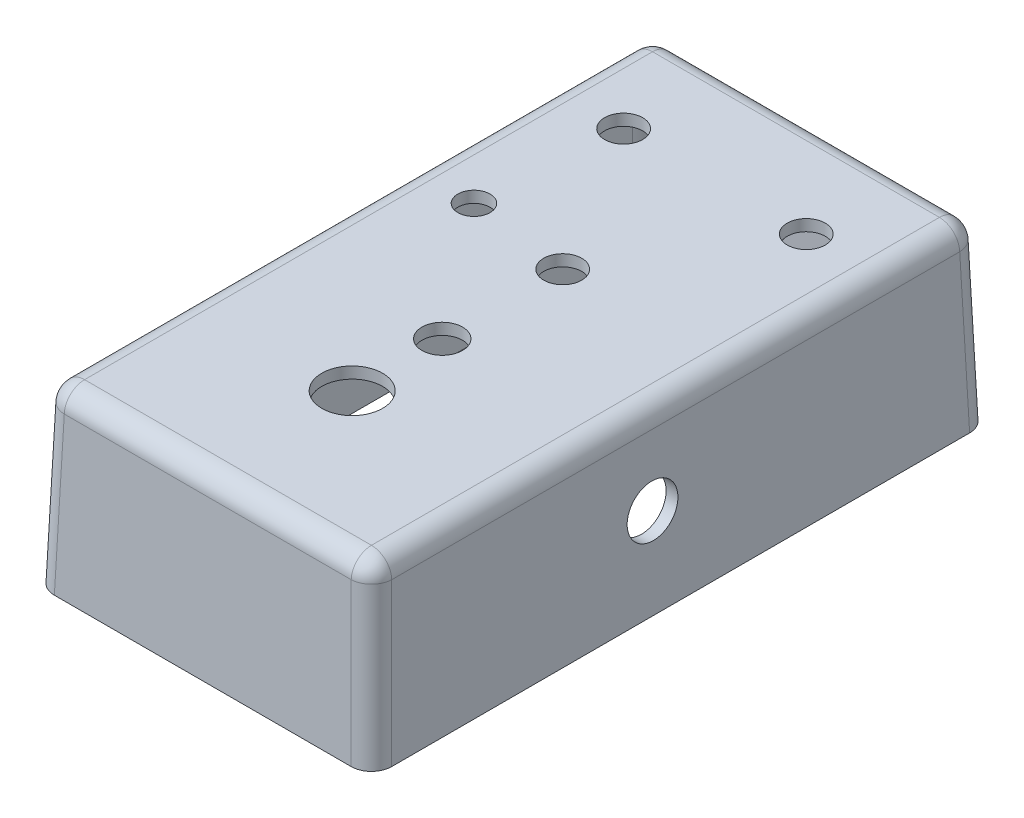
from build123d import *

# Parameters (mm, degrees)
SKETCH1_W              = 66.5
SKETCH1_H              = 121.9
BOX_DEPTH              = 34.8
SKETCH4_W              = 62
SKETCH4_H              = 117.4
HOLLOW_DEPTH           = 32.55
SIDE_WALL_DRAFT_SIZE   = 34.8
SIDE_WALL_DRAFT_SIZE_2 = 1.1
CORNER_ROUNDING_R      = 4
SKETCH2_R              = 3.75
SKETCH2_R_2            = 4
SKETCH2_R_3            = 6
SKETCH2_R_4            = 3.175
TOP_SIDE_CUT_DEPTH     = 22.5
SKETCH6_R              = 5
INPUT_JACK_DEPTH       = 10
SKETCH7_R              = 5
OUTPUT_JACK_DEPTH      = 10


with BuildPart() as part:
    # Sketch1 → Box (new body)
    with BuildSketch(Plane(origin=(0, 0, 0), x_dir=(1, 0, 0), z_dir=(0, 1, 0))):
        Rectangle(SKETCH1_W, SKETCH1_H)
    extrude(amount=-BOX_DEPTH)

    # Sketch4 → Hollow (cut)
    with BuildSketch(Plane.XZ.offset(34.8)):
        Rectangle(SKETCH4_W, SKETCH4_H)
    extrude(amount=-HOLLOW_DEPTH, mode=Mode.SUBTRACT)

    # Side wall draft
    # the kernel refuses this chamfer: 34.8, 1.1 mm, written as the material it adds along each edge
    with BuildSketch(Plane(origin=(-31, -2.25, 58.7), x_dir=(-0.001215153825981483, -0.999999261700317, 0), z_dir=(0, 0, -1))) as side_wall_draft_piece_1_section:
        Polygon((SIDE_WALL_DRAFT_SIZE * 0.9999992617, -SIDE_WALL_DRAFT_SIZE * 0.00121515382598), (-SIDE_WALL_DRAFT_SIZE_2 * 0.00121515382598, -SIDE_WALL_DRAFT_SIZE_2 * 0.9999992617), (0, 0), align=None)
    side_wall_draft_piece_1 = extrude(amount=117.4, mode=Mode.PRIVATE)
    side_wall_draft_piece_1 = split(side_wall_draft_piece_1, bisect_by=Plane(origin=(-30.631893643, -34.8, 0), z_dir=(0, 1, 0)), keep=Keep.TOP, mode=Mode.PRIVATE)
    add(side_wall_draft_piece_1)
    with BuildSketch(Plane(origin=(31, -2.25, 58.7), x_dir=(0, -0.999999261700317, 0.0012151538259815812), z_dir=(-1, 0, 0))) as side_wall_draft_piece_2_section:
        Polygon((SIDE_WALL_DRAFT_SIZE * 0.9999992617, -SIDE_WALL_DRAFT_SIZE * 0.00121515382598), (-SIDE_WALL_DRAFT_SIZE_2 * 0.00121515382598, -SIDE_WALL_DRAFT_SIZE_2 * 0.9999992617), (0, 0), align=None)
    side_wall_draft_piece_2 = extrude(amount=62, mode=Mode.PRIVATE)
    side_wall_draft_piece_2 = split(side_wall_draft_piece_2, bisect_by=Plane(origin=(0, -34.8, 58.331893643), z_dir=(0, 1, 0)), keep=Keep.TOP, mode=Mode.PRIVATE)
    add(side_wall_draft_piece_2)
    with BuildSketch(Plane(origin=(31, -2.25, -58.7), x_dir=(0.001215153825981483, -0.999999261700317, 0), z_dir=(0, 0, 1))) as side_wall_draft_piece_3_section:
        Polygon((SIDE_WALL_DRAFT_SIZE * 0.9999992617, -SIDE_WALL_DRAFT_SIZE * 0.00121515382598), (-SIDE_WALL_DRAFT_SIZE_2 * 0.00121515382598, -SIDE_WALL_DRAFT_SIZE_2 * 0.9999992617), (0, 0), align=None)
    side_wall_draft_piece_3 = extrude(amount=117.4, mode=Mode.PRIVATE)
    side_wall_draft_piece_3 = split(side_wall_draft_piece_3, bisect_by=Plane(origin=(30.631893643, -34.8, 0), z_dir=(0, 1, 0)), keep=Keep.TOP, mode=Mode.PRIVATE)
    add(side_wall_draft_piece_3)
    with BuildSketch(Plane(origin=(-31, -2.25, -58.7), x_dir=(0, -0.999999261700317, -0.0012151538259815812), z_dir=(1, 0, 0))) as side_wall_draft_piece_4_section:
        Polygon((SIDE_WALL_DRAFT_SIZE * 0.9999992617, -SIDE_WALL_DRAFT_SIZE * 0.00121515382598), (-SIDE_WALL_DRAFT_SIZE_2 * 0.00121515382598, -SIDE_WALL_DRAFT_SIZE_2 * 0.9999992617), (0, 0), align=None)
    side_wall_draft_piece_4 = extrude(amount=62, mode=Mode.PRIVATE)
    side_wall_draft_piece_4 = split(side_wall_draft_piece_4, bisect_by=Plane(origin=(0, -34.8, -58.331893643), z_dir=(0, 1, 0)), keep=Keep.TOP, mode=Mode.PRIVATE)
    add(side_wall_draft_piece_4)
    # the kernel refuses this chamfer: 34.8, 1.1 mm, written as the material it takes off along each edge
    with BuildSketch(Plane(origin=(-123.728329596, 0, 60.95), x_dir=(0, -0.999999261700317, 0.0012151538259815812), z_dir=(1, 0, 0))) as side_wall_draft_2_piece_1:
        Polygon((SIDE_WALL_DRAFT_SIZE * 0.9999992617, SIDE_WALL_DRAFT_SIZE * 0.00121515382598), (-SIDE_WALL_DRAFT_SIZE_2 * 0.00121515382598, SIDE_WALL_DRAFT_SIZE_2 * 0.9999992617), (0, 0), align=None)
    extrude(amount=247.456659192, mode=Mode.SUBTRACT)
    with BuildSketch(Plane(origin=(-33.25, 0, -151.428329596), x_dir=(-0.0012151538259815812, -0.999999261700317, 0), z_dir=(0, 0, 1)), Plane(origin=(33.25, 0, 151.428329596), x_dir=(0.0012151538259815812, -0.999999261700317, 0), z_dir=(0, 0, -1))) as side_wall_draft_2_piece_2:
        Polygon((SIDE_WALL_DRAFT_SIZE * 0.9999992617, SIDE_WALL_DRAFT_SIZE * 0.00121515382598), (-SIDE_WALL_DRAFT_SIZE_2 * 0.00121515382598, SIDE_WALL_DRAFT_SIZE_2 * 0.9999992617), (0, 0), align=None)
    extrude(amount=302.856659192, mode=Mode.SUBTRACT)
    with BuildSketch(Plane(origin=(123.728329596, 0, -60.95), x_dir=(0, 0.7724211149227607, 0.6351107157192984), z_dir=(-1, 0, 0))) as side_wall_draft_2_piece_3:
        Polygon((SIDE_WALL_DRAFT_SIZE_2 * 0.635110715719, -SIDE_WALL_DRAFT_SIZE_2 * 0.772421114923), (-SIDE_WALL_DRAFT_SIZE * 0.772421114923, -SIDE_WALL_DRAFT_SIZE * 0.635110715719), (0, 0), align=None)
    extrude(amount=247.456659192, mode=Mode.SUBTRACT)

    # Corner rounding
    corner_rounding_edges = [part.edges().sort_by_distance(p)[0] for p in [
        (0, -2.25, -57.6),
        (29.9, -2.25, 0),
        (0, -2.25, 57.6),
        (-29.9, -2.25, 0),
        (32.15, 0, 0),
        (0, 0, -59.85),
        (-32.15, 0, 0),
        (0, 0, 59.85),
        (30.414439655, -18.525, 58.114439655),
        (30.414439655, -18.525, -58.114439655),
        (-30.414439655, -18.525, 58.114439655),
        (-30.414439655, -18.525, -58.114439655),
        (-32.7, -17.4, -60.4),
        (32.7, -17.4, -60.4),
        (-32.7, -17.4, 60.4),
        (32.7, -17.4, 60.4),
    ]]
    fillet(corner_rounding_edges, radius=CORNER_ROUNDING_R)

    # Sketch2 → Top side cut (cut)
    with BuildSketch(Plane(origin=(0, 0, 0), x_dir=(1, 0, 0), z_dir=(0, 1, 0))):
        with Locations(Location((-18, 40, 0), (0, 0, 270))):
            Circle(SKETCH2_R)
        with Locations(Location((0, -13.75, 0), (0, 0, 270))):
            Circle(SKETCH2_R_2)
        with Locations(Location((0, -31.5, 0), (0, 0, 270))):
            Circle(SKETCH2_R_3)
        with Locations(Location((-20, 12.5, 0), (0, 0, 270))):
            Circle(SKETCH2_R_4)
        with Locations(Location((18, 40, 0), (0, 0, 270))):
            Circle(SKETCH2_R)
        with Locations(Location((0, 10, 0), (0, 0, 270))):
            Circle(SKETCH2_R)
    extrude(amount=-TOP_SIDE_CUT_DEPTH, mode=Mode.SUBTRACT)

    # Sketch6 → Input Jack (cut)
    with BuildSketch(Plane(origin=(32.117909672, 1.015221283, 0), x_dir=(0, 0, -1), z_dir=(0.9995008034277885, 0.03159341620030004, 0))):
        with Locations(Location((-5, -18.415728331, 0), (0, 0, 90))):
            Circle(SKETCH6_R)
    extrude(amount=-INPUT_JACK_DEPTH, mode=Mode.SUBTRACT)

    # Sketch7 → Output Jack (cut)
    with BuildSketch(Plane(origin=(-32.117909672, 1.015221283, 0), x_dir=(0, 0, 1), z_dir=(-0.9995008034277885, 0.03159341620030004, 0))):
        with Locations(Location((5, -18.293286119, 0), (0, 0, 270))):
            Circle(SKETCH7_R)
    extrude(amount=-OUTPUT_JACK_DEPTH, mode=Mode.SUBTRACT)


solid = part.part
